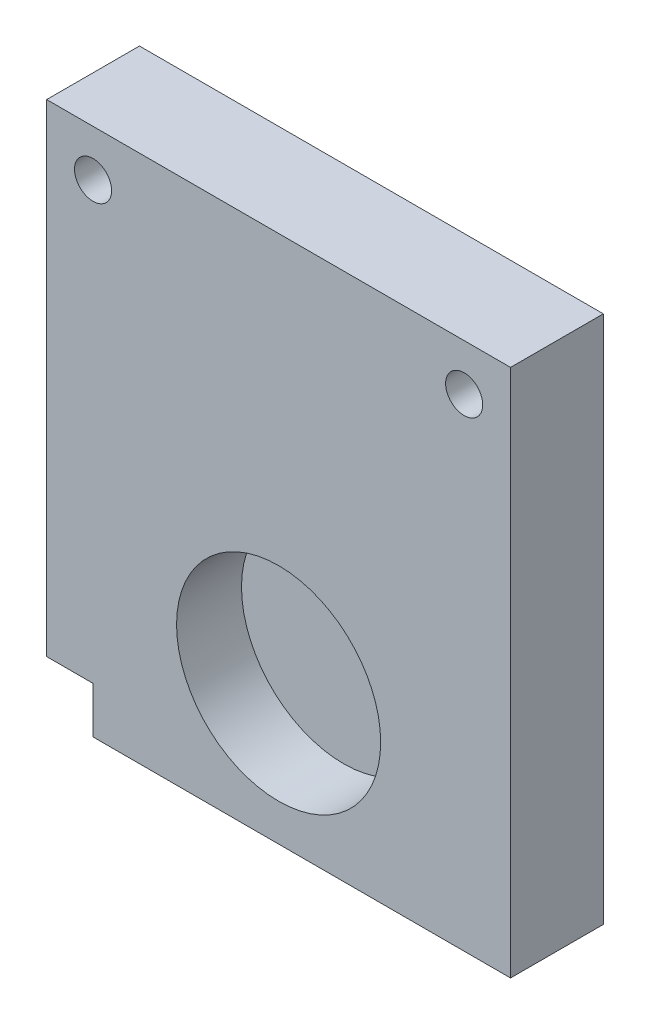
from build123d import *

# Parameters (mm, degrees)
BOSS_EXTRU_1_DEPTH      = 10
ESQUISSE2_R             = 2
ENL_V_MAT_EXTRU_1_DEPTH = 10
ESQUISSE3_R             = 2
ENL_V_MAT_EXTRU_2_DEPTH = 51.549975886
CHANFREIN1_SIZE         = 2.5
ESQUISSE4_R             = 11
ENL_V_MAT_EXTRU_3_DEPTH = 7


with BuildPart() as part:
    # Esquisse1 → Boss.-Extru.1 (new body)
    with BuildSketch(Plane.XY):
        Polygon((-20.372003094, -12.282474128), (-15.372003094, -12.282474128), (-15.372003094, -17.282474128), (29.627996906, -17.282474128), (29.627996906, 39.717525872), (-20.372003094, 39.717525872), align=None)
    extrude(amount=BOSS_EXTRU_1_DEPTH)

    # Esquisse2 → Enlèv. mat.-Extru.1 (cut)
    with BuildSketch(Plane.XZ.offset(17.282474128)):
        with Locations((-10.372003094, 5)):
            Circle(ESQUISSE2_R)
        with Locations((19.627996906, 5)):
            Circle(ESQUISSE2_R)
    extrude(amount=-ENL_V_MAT_EXTRU_1_DEPTH, mode=Mode.SUBTRACT)

    # Esquisse3 → Enlèv. mat.-Extru.2 (cut, through all)
    with BuildSketch(Plane.XY.offset(10)):
        with Locations((-15.372003094, 34.717525872)):
            Circle(ESQUISSE3_R)
        with Locations((24.627996906, 34.717525872)):
            Circle(ESQUISSE3_R)
    extrude(amount=-ENL_V_MAT_EXTRU_2_DEPTH, mode=Mode.SUBTRACT)

    # Chanfrein1
    chanfrein1_edges = [part.edges().sort_by_distance(p)[0] for p in [
        (22.627996906, 34.717525872, 0),
        (-17.372003094, 34.717525872, 0),
    ]]
    chamfer(chanfrein1_edges, length=CHANFREIN1_SIZE)

    # Esquisse4 → Enlèv. mat.-Extru.3 (cut)
    with BuildSketch(Plane.XY.offset(10)):
        with Locations((4.627996906, -2.282474128)):
            Circle(ESQUISSE4_R)
    extrude(amount=-ENL_V_MAT_EXTRU_3_DEPTH, mode=Mode.SUBTRACT)


solid = part.part
